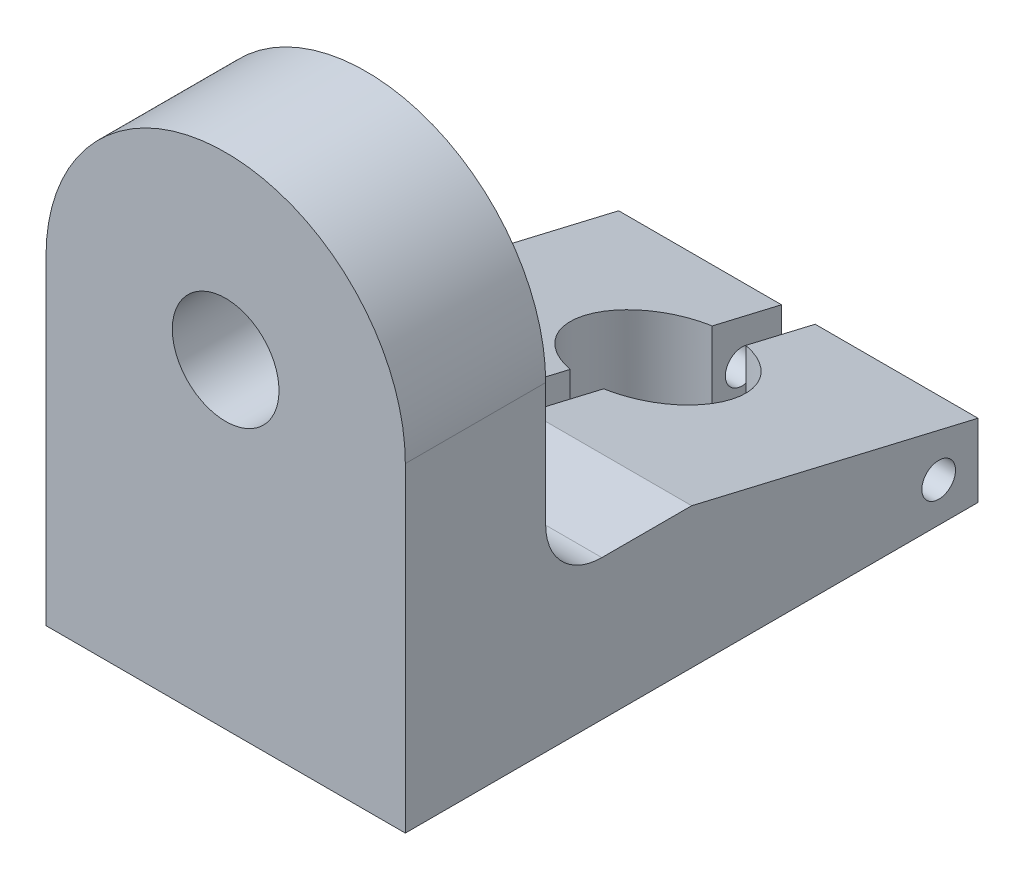
from build123d import *

# Parameters (mm, degrees)
ESTRUSIONE_ESTRUSIONE1_DEPTH = 64
RACCORDO1_RADIUS             = 32
RACCORDO1_LENGTH             = 25
SCHIZZO2_R                   = 13
TAGLIO_ESTRUSIONE1_DEPTH     = 119.831813922
SCHIZZO5_W                   = 6
SCHIZZO5_H                   = 64
TAGLIO_ESTRUSIONE2_DEPTH     = 119.831813922
TAGLIO_ESTRUSIONE3_DEPTH     = 119.831813922
SCHIZZO7_R                   = 3
TAGLIO_ESTRUSIONE4_DEPTH     = 119.831813922
SCHIZZO8_R                   = 12.5
ESTRUSIONE_ESTRUSIONE2_DEPTH = 5
SCHIZZO9_R                   = 9.5
TAGLIO_ESTRUSIONE5_DEPTH     = 116.654658358
RACCORDO2_R                  = 10
RACCORDO3_R                  = 5


with BuildPart() as part:
    # Schizzo1 → Estrusione-Estrusione1 (new body)
    with BuildSketch(Plane(origin=(0, 0, 0), x_dir=(0, 0, -1), z_dir=(1, 0, 0))):
        Polygon((0, 0), (77, 0), (77, -25), (-25, -25), (-25, 64), (0, 64), align=None)
    extrude(amount=-ESTRUSIONE_ESTRUSIONE1_DEPTH)

    # Raccordo1: full round fillet: the end face becomes a half cylinder, R = half its width
    raccordo1_face = Plane((-32, 64, 12.5), x_dir=(0, 0, -1), z_dir=(0, 1, 0))  # on the end face: x along it, z out of the body
    raccordo1_slab = raccordo1_face.offset(-RACCORDO1_RADIUS / 2) * Box(RACCORDO1_LENGTH, 2 * RACCORDO1_RADIUS, RACCORDO1_RADIUS, mode=Mode.PRIVATE)  # the body's end, R deep
    raccordo1_round = Plane((-32, 32, 12.5), x_dir=(0, 1, 0), z_dir=(0, 0, -1)) * Cylinder(RACCORDO1_RADIUS, RACCORDO1_LENGTH, mode=Mode.PRIVATE)  # its axis R under the face
    add(raccordo1_slab - raccordo1_round, mode=Mode.SUBTRACT)

    # Schizzo2 → Taglio-Estrusione1 (cut, through all)
    with BuildSketch(Plane(origin=(0, 0, 0), x_dir=(1, 0, 0), z_dir=(0, 1, 0))):
        with Locations(Location((-32, 52, 0), (0, 0, 270))):
            Circle(SCHIZZO2_R)
    extrude(amount=-TAGLIO_ESTRUSIONE1_DEPTH, mode=Mode.SUBTRACT)

    # Schizzo5 → Taglio-Estrusione2 (cut, through all)
    with BuildSketch(Plane(origin=(0, 0, 0), x_dir=(1, 0, 0), z_dir=(0, 1, 0))):
        with Locations((-32, 45)):
            Rectangle(SCHIZZO5_W, SCHIZZO5_H)
    extrude(amount=-TAGLIO_ESTRUSIONE2_DEPTH, mode=Mode.SUBTRACT)

    # Schizzo6 → Taglio-Estrusione3 (cut, through all)
    with BuildSketch(Plane(origin=(0, 0, 0), x_dir=(0, 0, -1), z_dir=(1, 0, 0))):
        Polygon((26, 0), (77, -12), (77, 0), align=None)
    extrude(amount=-TAGLIO_ESTRUSIONE3_DEPTH, mode=Mode.SUBTRACT)

    # Schizzo7 → Taglio-Estrusione4 (cut, through all)
    with BuildSketch(Plane(origin=(0, 0, 0), x_dir=(0, 0, -1), z_dir=(1, 0, 0))):
        with Locations((70, -18)):
            Circle(SCHIZZO7_R)
    extrude(amount=-TAGLIO_ESTRUSIONE4_DEPTH, mode=Mode.SUBTRACT)

    # Schizzo8 → Estrusione-Estrusione2 (add)
    with BuildSketch(Plane(origin=(0, 0, 0), x_dir=(-1, 0, 0), z_dir=(0, 0, -1))):
        with Locations((32, 32)):
            Circle(SCHIZZO8_R)
    extrude(amount=ESTRUSIONE_ESTRUSIONE2_DEPTH)

    # Schizzo9 → Taglio-Estrusione5 (cut, through all)
    with BuildSketch(Plane(origin=(0, 0, -5), x_dir=(-1, 0, 0), z_dir=(0, 0, -1))):
        with Locations((32, 32)):
            Circle(SCHIZZO9_R)
    extrude(amount=-TAGLIO_ESTRUSIONE5_DEPTH, mode=Mode.SUBTRACT)

    # Raccordo2
    raccordo2_edges = [part.edges().sort_by_distance(p)[0] for p in [
        (-32, 0, 0),
    ]]
    fillet(raccordo2_edges, radius=RACCORDO2_R)

    # Raccordo3
    raccordo3_edges = [part.edges().sort_by_distance(p)[0] for p in [
        (-19.5, 32, 0),
    ]]
    fillet(raccordo3_edges, radius=RACCORDO3_R - 0.0001)  # a hair under: the kernel refuses the full size


solid = part.part
